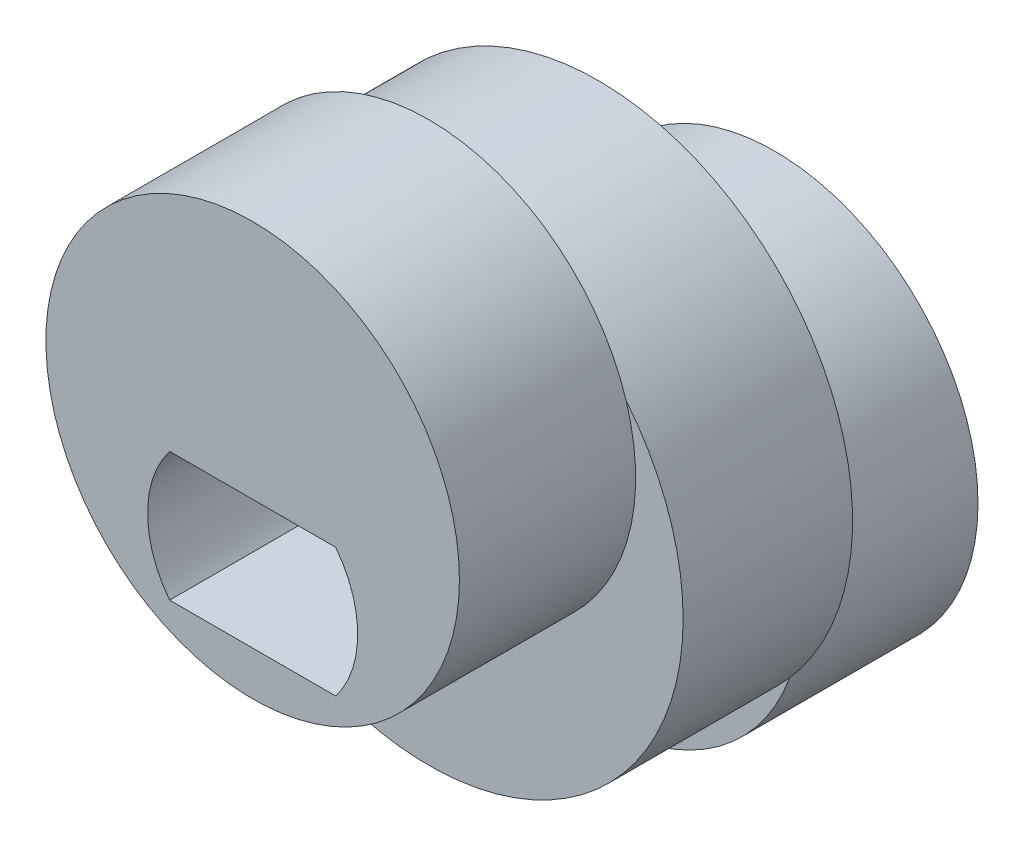
from build123d import *

# Parameters (mm, degrees)
SKETCH6_R               = 7.5
BOSS_EXTRUDE4_DEPTH     = 2.5
SKETCH7_R               = 6.1
BOSS_EXTRUDE5_DEPTH     = 5.2
SKETCH8_R               = 6
BOSS_EXTRUDE6_DEPTH     = 5.2
CUT_EXTRUDE1_DEPTH      = 16.533512159
CUT_EXTRUDE1_DEPTH_BACK = 16.533512159


with BuildPart() as part:
    # Sketch6 → Boss-Extrude4 (new, symmetric)
    with BuildSketch(Plane.XY):
        Circle(SKETCH6_R)
    extrude(amount=BOSS_EXTRUDE4_DEPTH, both=True)

    # Sketch7 → Boss-Extrude5 (add)
    with BuildSketch(Plane.XY.offset(2.5)):
        with Locations((0, 2.9)):
            Circle(SKETCH7_R)
    extrude(amount=BOSS_EXTRUDE5_DEPTH)

    # Sketch8 → Boss-Extrude6 (add)
    with BuildSketch(Plane(origin=(0, 0, -2.5), x_dir=(-1, 0, 0), z_dir=(0, 0, -1))):
        with Locations((0, -2.9)):
            Circle(SKETCH8_R)
    extrude(amount=BOSS_EXTRUDE6_DEPTH)

    # Sketch11 → Cut-Extrude1 (cut, two sides: drawn at the far end of the back side and taken through both)
    with BuildSketch(Plane.XY.offset(2.5).offset(-CUT_EXTRUDE1_DEPTH_BACK)):
        with BuildLine():
            Line((-2.449489743, -1.9), (2.449489743, -1.9))
            ThreePointArc((2.449489743, -1.9), (3.1, 0), (2.449489743, 1.9))
            Line((2.449489743, 1.9), (-2.449489743, 1.9))
            ThreePointArc((-2.449489743, 1.9), (-3.1, 0), (-2.449489743, -1.9))
        make_face()
    extrude(amount=CUT_EXTRUDE1_DEPTH + CUT_EXTRUDE1_DEPTH_BACK, mode=Mode.SUBTRACT)


solid = part.part
